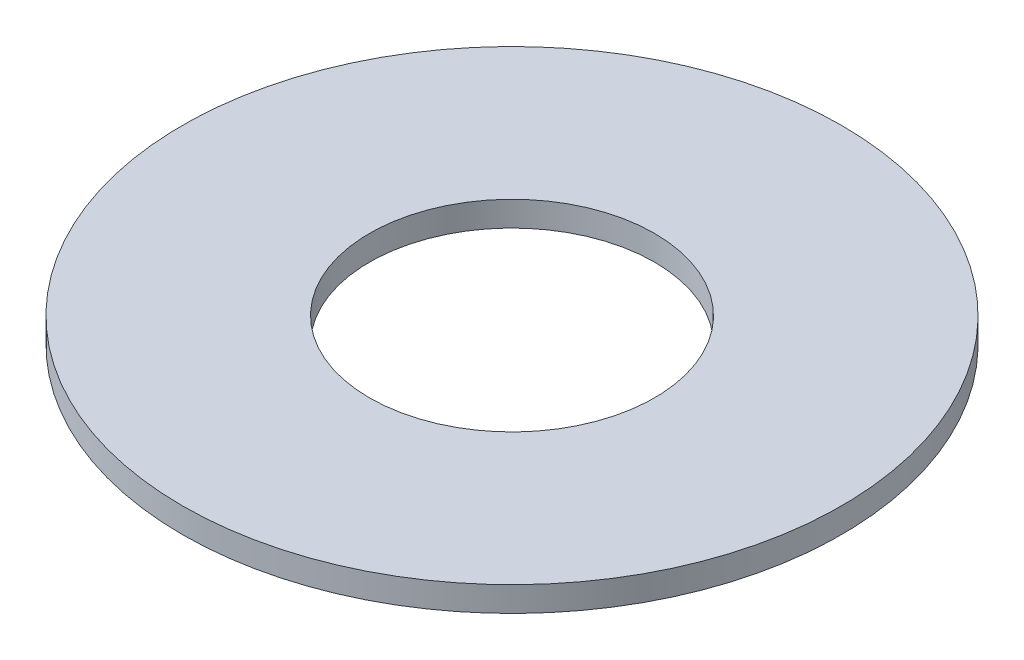
from build123d import *

# Parameters (mm, degrees)
SKETCH1_R           = 92.5
BOSS_EXTRUDE1_DEPTH = 7
SKETCH2_R           = 40
CUT_EXTRUDE1_DEPTH  = 132.001908383


with BuildPart() as part:
    # Sketch1 → Boss-Extrude1 (new body)
    with BuildSketch(Plane(origin=(0, 0, 0), x_dir=(1, 0, 0), z_dir=(0, 1, 0))):
        Circle(SKETCH1_R)
    extrude(amount=BOSS_EXTRUDE1_DEPTH)

    # Sketch2 → Cut-Extrude1 (cut, through all)
    with BuildSketch(Plane(origin=(0, 0, 0), x_dir=(1, 0, 0), z_dir=(0, 1, 0))):
        Circle(SKETCH2_R)
    extrude(amount=CUT_EXTRUDE1_DEPTH, mode=Mode.SUBTRACT)


solid = part.part
